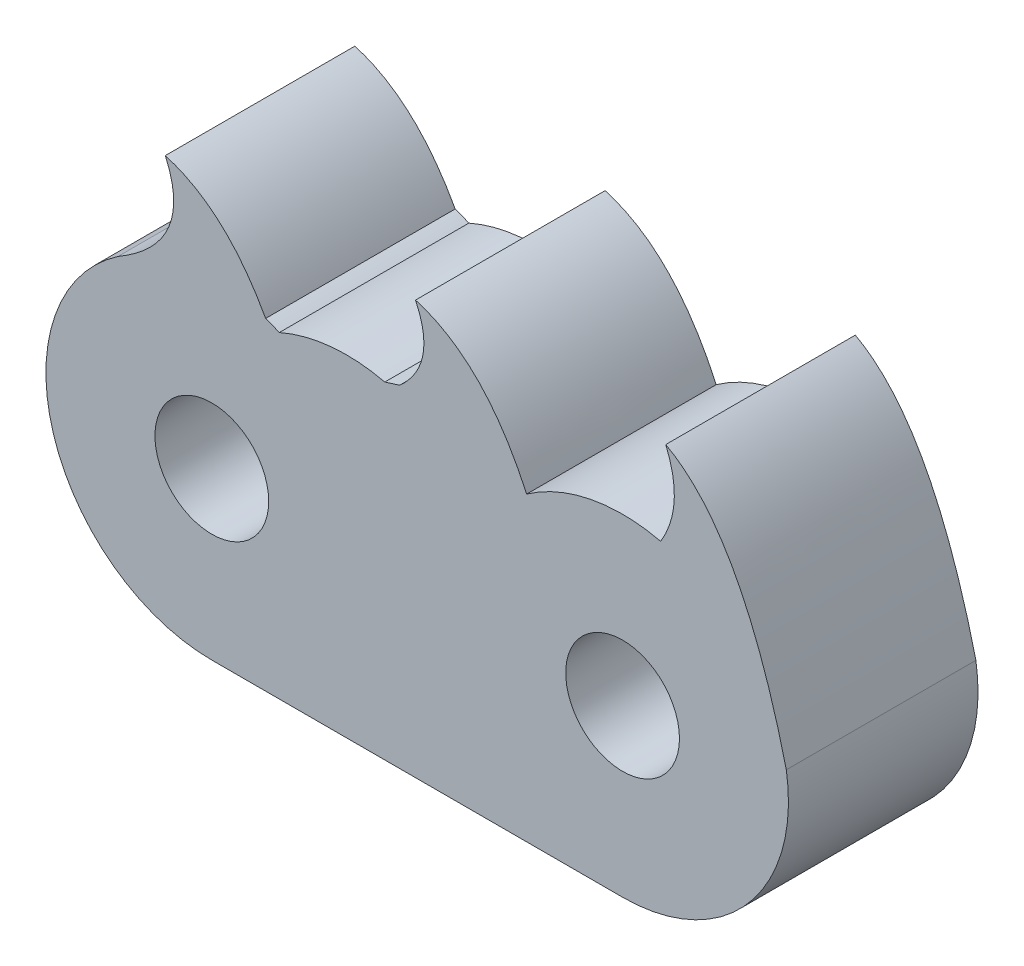
from build123d import *

# Parameters (mm, degrees)
BOSS_EXTRUDE1_DEPTH = 2
SKETCH2_R           = 0.6
CUT_EXTRUDE1_DEPTH  = 2
BOUNDARY_CUT1_START = 0.5
BOUNDARY_CUT1_DEPTH = 1


# Read off the part's stored shape, not the designer's step: Boundary-Cut1
with BuildPart() as part:
    # Sketch1 → Boss-Extrude1 (new body)
    with BuildSketch(Plane.XY):
        with BuildLine():
            ThreePointArc((1.526225881, 1.443320919), (0.844261398, -0.518019494), (2.515834251, -1.75))
            Line((2.515834251, -1.75), (6.849532383, -1.75))
            ThreePointArc((6.849532383, -1.75), (8.181942233, -1.134541314), (8.577159836, 0.278932579))
            add(Edge.make_bspline(
                [(8.577159836, 0.278932579), (8.110700048, 2.179296341), (7.304925461, 2.614034863)],
                knots=[0, 0, 0, 1, 1, 1], degree=2))
            add(Edge.make_bspline(
                [(7.304925461, 2.614034863), (7.441478628, 2.291307156), (7.423521915, 1.987733608), (7.251055322, 1.703314219)],
                knots=[0, 0, 0, 0, 0.668538786, 0.668538786, 0.668538786, 0.668538786], degree=3))
            ThreePointArc((7.251055322, 1.703314219), (6.514478451, 1.717625938), (5.837281377, 1.427532101))
            add(Edge.make_bspline(
                [(5.837281377, 1.427532101), (5.390462193, 2.403045527), (4.664925461, 2.614034863)],
                knots=[0.307788008, 0.307788008, 0.307788008, 1, 1, 1], degree=2))
            add(Edge.make_bspline(
                [(4.664925461, 2.614034863), (4.824318966, 2.283493667), (4.768740332, 1.996314703), (4.498189559, 1.752497972)],
                knots=[0, 0, 0, 0, 0.792020938, 0.792020938, 0.792020938, 0.792020938], degree=3))
            Line((4.498189559, 1.752497972), (4.341055322, 1.703314219))
            ThreePointArc((4.341055322, 1.703314219), (3.775786335, 1.742322367), (3.227683317, 1.598677862))
            ThreePointArc((3.227683317, 1.598677862), (3.156194107, 1.628631099), (3.083448661, 1.655389344))
            add(Edge.make_bspline(
                [(3.083448661, 1.655389344), (2.661448554, 2.428931092), (2.024925461, 2.614034863)],
                knots=[0.392713148, 0.392713148, 0.392713148, 1, 1, 1], degree=2))
            add(Edge.make_bspline(
                [(2.024925461, 2.614034863), (2.317287968, 1.973197345), (1.646435899, 1.518764796)],
                knots=[0, 0, 0, 0.922107406, 0.922107406, 0.922107406], degree=2))
            add(Edge.make_bspline(
                [(1.646435899, 1.518764796), (1.589767438, 1.480377803), (1.526225881, 1.443320919)],
                knots=[0.922107406, 0.922107406, 0.922107406, 1, 1, 1], degree=2))
        make_face()
    extrude(amount=BOSS_EXTRUDE1_DEPTH)

    # Sketch2 → Cut-Extrude1 (cut)
    with BuildSketch(Plane.XY.offset(2)):
        with Locations((6.849532383, 0)):
            Circle(SKETCH2_R)
        with Locations((2.515834251, 0)):
            Circle(SKETCH2_R)
    extrude(amount=-CUT_EXTRUDE1_DEPTH, mode=Mode.SUBTRACT)

    # Boundary-Cut1 outline → Boundary-Cut1 (cut)
    with BuildSketch(Plane.XY.offset(BOUNDARY_CUT1_START)):
        with BuildLine():
            add(Edge.make_bspline(
                [(3.182683317, -1.75), (3.219559269, -1.676248097), (3.293311172, -1.528744291), (3.403939026, -1.307488582), (3.51456688, -1.086232874), (3.588340093, -0.938686449), (3.678709694, -0.757947245), (3.783775446, -0.543015437), (3.935584986, -0.217797229), (4.081534514, 0.110092623), (4.174899608, 0.330404865), (4.258110172, 0.531765281), (4.388021164, 0.690444526), (4.682683317, 0.779920411), (4.97734547, 0.690444526), (5.107256462, 0.531765281), (5.190467027, 0.330404865), (5.28383212, 0.110092623), (5.429781648, -0.217797229), (5.581591188, -0.543015437), (5.686671615, -0.757976596), (5.7401719, -0.864977165)],
                knots=[0, 0, 0, 0, 0.049050349, 0.098100699, 0.147151048, 0.196201398, 0.196201398, 0.267425193, 0.338648988, 0.409872783, 0.481096578, 0.481096578, 0.539598638, 0.598100699, 0.656602759, 0.71510482, 0.71510482, 0.786328615, 0.85755241, 0.928776205, 1, 1, 1, 1], degree=3))
            Line((3.182683317, -1.75), (6.182683317, -1.75))
            Line((6.182683317, -1.75), (5.7401719, -0.864977165))
        make_face()
    extrude(amount=BOUNDARY_CUT1_DEPTH, mode=Mode.SUBTRACT)


solid = part.part
